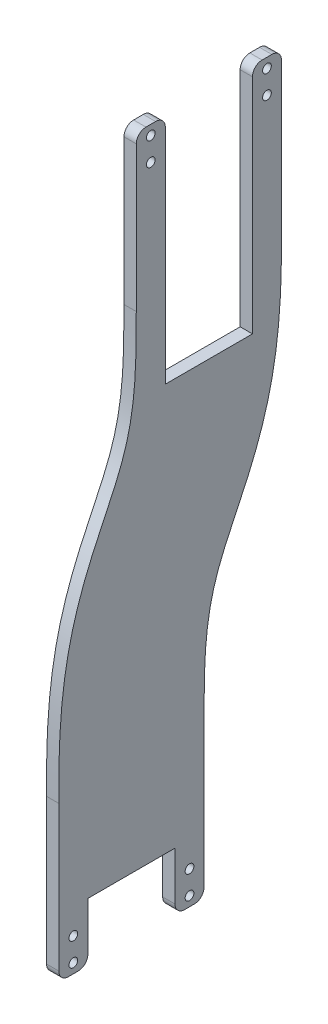
from build123d import *

# Parameters (mm, degrees)
SALIENTE_EXTRUIR1_DEPTH      = 6.35
TALADRO_DE_MARGEN_PARA_M41_D = 4.5
REDONDEO1_R                  = 5


# Read off the part's stored shape, not the designer's step: Saliente-Extruir1
with BuildPart() as part:
    # Saliente-Extruir1 outline → Saliente-Extruir1 (new body)
    with BuildSketch(Plane(origin=(0, 0, 0), x_dir=(0, 0, -1), z_dir=(1, 0, 0))):
        with BuildLine():
            Line((-2.5, 180), (-17.5, 180))
            Line((-17.5, 180), (-17.5, 100))
            add(Edge.make_bspline(
                [(-17.5, 100), (-17.5, 98.712751966), (-17.500047788, 96.116321069), (-17.51148981, 91.098940131), (-17.565479393, 85.046877218), (-17.737925717, 78.203948852), (-18.147729277, 69.656133307), (-19.038911227, 60.095322328), (-20.718334539, 50.310614009), (-22.956153632, 41.771686415), (-25.785586207, 33.773608765), (-29.338865081, 25.548124026), (-33.697565336, 16.449967912), (-38.713561507, 6.016494532), (-43.953609584, -6.016361906), (-48.809754323, -19.661313126), (-52.733015331, -34.671033487), (-55.439087369, -50.654463146), (-56.694005293, -64.452671708), (-57.222054598, -75.565918854), (-57.428472519, -83.87427142), (-57.487938926, -90.701655992), (-57.499988878, -96.070691027), (-57.5, -98.684323127), (-57.5, -100)],
                knots=[0, 0, 0, 0, 0.015625, 0.03125, 0.0625, 0.09375, 0.125, 0.1875, 0.25, 0.3125, 0.375, 0.4375, 0.5, 0.5625, 0.625, 0.6875, 0.75, 0.8125, 0.875, 0.90625, 0.9375, 0.96875, 0.984375, 1, 1, 1, 1], degree=3))
            Line((-57.5, -100), (-57.5, -180))
            Line((-57.5, -180), (-42.5, -180))
            Line((-42.5, -180), (-42.5, -150))
            Line((-42.5, -150), (2.5, -150))
            Line((2.5, -150), (2.5, -180))
            Line((2.5, -180), (17.5, -180))
            Line((17.5, -180), (17.5, -100))
            add(Edge.make_bspline(
                [(17.5, -100), (17.5, -98.712751966), (17.500047788, -96.116321069), (17.51148981, -91.098940131), (17.565479393, -85.046877218), (17.737925717, -78.203948852), (18.147729277, -69.656133307), (19.038911227, -60.095322328), (20.718334539, -50.310614009), (22.956153632, -41.771686415), (25.785586207, -33.773608765), (29.338865081, -25.548124026), (33.697565336, -16.449967912), (38.713561507, -6.016494532), (43.953609584, 6.016361906), (48.809754323, 19.661313126), (52.733015331, 34.671033487), (55.439087369, 50.654463146), (56.694005293, 64.452671708), (57.222054598, 75.565918854), (57.428472519, 83.87427142), (57.487938926, 90.701655992), (57.499988878, 96.070691027), (57.5, 98.684323127), (57.5, 100)],
                knots=[0, 0, 0, 0, 0.015625, 0.03125, 0.0625, 0.09375, 0.125, 0.1875, 0.25, 0.3125, 0.375, 0.4375, 0.5, 0.5625, 0.625, 0.6875, 0.75, 0.8125, 0.875, 0.90625, 0.9375, 0.96875, 0.984375, 1, 1, 1, 1], degree=3))
            Line((57.5, 100), (57.5, 180))
            Line((57.5, 180), (42.5, 180))
            Line((42.5, 180), (42.5, 60))
            Line((42.5, 60), (-2.5, 60))
            Line((-2.5, 60), (-2.5, 180))
        make_face()
    extrude(amount=SALIENTE_EXTRUIR1_DEPTH)

    # Taladro de margen para M41 (through all)
    with Locations(Plane.ZY):
        with Locations((10, 163), (10, 175), (-50, 163), (-50, 175), (50, -175), (50, -163), (-10, -175), (-10, -163)):
            Hole(TALADRO_DE_MARGEN_PARA_M41_D / 2)

    # Redondeo1
    redondeo1_edges = [part.edges().sort_by_distance(p)[0] for p in [
        (3.175, 180, 2.5),
        (3.175, 180, -42.5),
        (3.175, 180, -57.5),
        (3.175, -180, -17.5),
        (3.175, -180, -2.5),
        (3.175, -180, 42.5),
        (3.175, -180, 57.5),
        (3.175, 180, 17.5),
    ]]
    fillet(redondeo1_edges, radius=REDONDEO1_R)


solid = part.part
